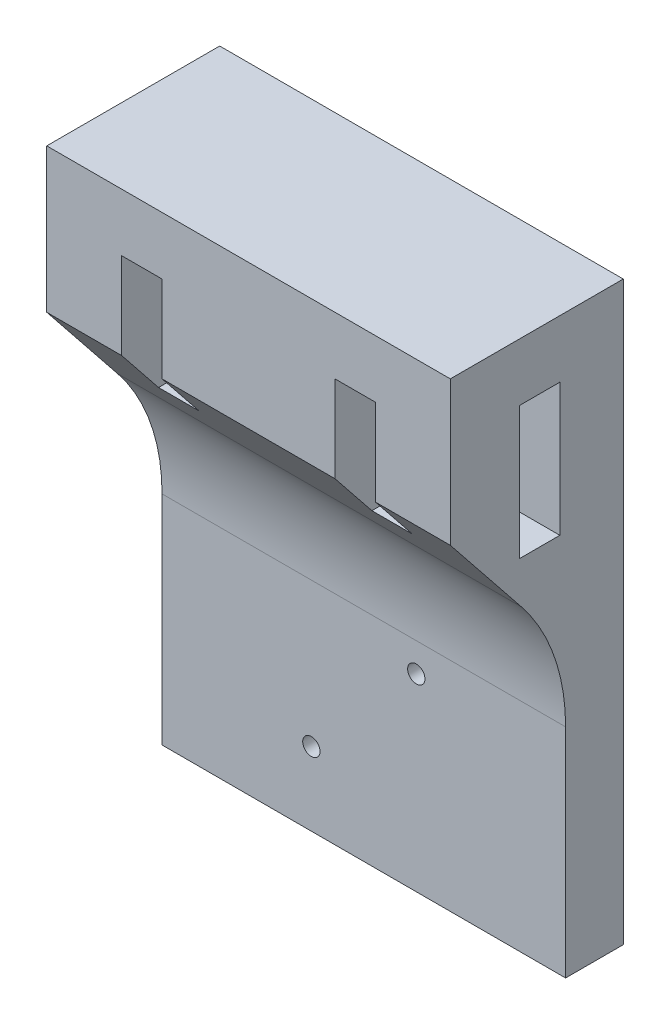
from build123d import *

# Parameters (mm, degrees)
SKETCH1_W           = 70
SKETCH1_H           = 100
BOSS_EXTRUDE1_DEPTH = 30
SKETCH2_W           = 7
SKETCH2_H           = 23
CUT_EXTRUDE1_DEPTH  = 20
SKETCH3_W           = 7
SKETCH3_H           = 23
CUT_EXTRUDE2_DEPTH  = 16
CUT_EXTRUDE3_DEPTH  = 126.6980509
SKETCH5_R           = 1.5
CUT_EXTRUDE4_DEPTH  = 10


with BuildPart() as part:
    # Sketch1 → Boss-Extrude1 (new body)
    with BuildSketch(Plane.XY):
        with Locations((35, 50)):
            Rectangle(SKETCH1_W, SKETCH1_H)
    extrude(amount=BOSS_EXTRUDE1_DEPTH)

    # Sketch2 → Cut-Extrude1 (cut)
    with BuildSketch(Plane.ZY):
        with Locations((14.5, 78.5)):
            Rectangle(SKETCH2_W, SKETCH2_H)
    cut_extrude1 = extrude(amount=-CUT_EXTRUDE1_DEPTH, mode=Mode.SUBTRACT)

    # Sketch3 → Cut-Extrude2 (cut)
    with BuildSketch(Plane.XY.offset(30)):
        with Locations((16.5, 78.5)):
            Rectangle(SKETCH3_W, SKETCH3_H)
    cut_extrude2 = extrude(amount=-CUT_EXTRUDE2_DEPTH, mode=Mode.SUBTRACT)

    # Mirror1: Cut-Extrude1, Cut-Extrude2 across plane
    add(cut_extrude1.mirror(Plane.ZY.offset(-35)), mode=Mode.SUBTRACT)
    add(cut_extrude2.mirror(Plane.ZY.offset(-35)), mode=Mode.SUBTRACT)

    # Sketch4 → Cut-Extrude3 (cut, through all)
    with BuildSketch(Plane.ZY):
        with BuildLine():
            ThreePointArc((17.669591669, 59.586989587), (11.973008829, 49.307905873), (10, 37.722662922))
            Line((10, 37.722662922), (10, 0))
            Line((10, 0), (30, 0))
            Line((30, 0), (30, 75))
            Line((30, 75), (17.669591669, 59.586989587))
        make_face()
    extrude(amount=-CUT_EXTRUDE3_DEPTH, mode=Mode.SUBTRACT)

    # Sketch5 → Cut-Extrude4 (cut)
    with BuildSketch(Plane.XY.offset(10)):
        with Locations((44.1, 32.722662922)):
            Circle(SKETCH5_R)
        with Locations((25.9, 12.722662922)):
            Circle(SKETCH5_R)
    extrude(amount=-CUT_EXTRUDE4_DEPTH, mode=Mode.SUBTRACT)


solid = part.part
